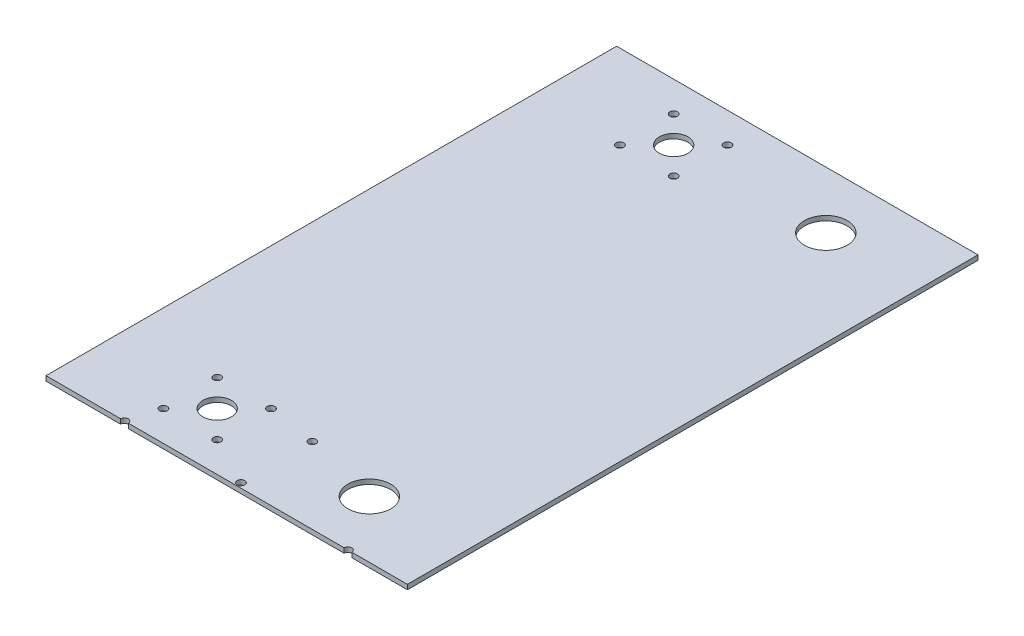
from build123d import *

# Parameters (mm, degrees)
SKETCH1_W           = 241.3
SKETCH1_H           = 381
BOSS_EXTRUDE1_DEPTH = 3.175
SKETCH7_R           = 14.2875
SKETCH7_R_2         = 9.525
SKETCH7_R_3         = 2.5527
AXLE_HOLES_DEPTH    = 226.514418885
SKETCH10_R          = 2.5527
CUT_EXTRUDE5_DEPTH  = 226.514418885


with BuildPart() as part:
    # Sketch1 → Boss-Extrude1 (new body)
    with BuildSketch(Plane(origin=(0, 0, 0), x_dir=(1, 0, 0), z_dir=(0, 1, 0))):
        Rectangle(SKETCH1_W, SKETCH1_H)
    extrude(amount=BOSS_EXTRUDE1_DEPTH)

    # Sketch7 → Axle Holes (cut, through all)
    with BuildSketch(Plane(origin=(0, 3.175, 0), x_dir=(1, 0, 0), z_dir=(0, 1, 0))):
        with Locations((57.15, -152.4)):
            Circle(SKETCH7_R)
        with Locations((57.15, 152.4)):
            Circle(SKETCH7_R)
        with Locations((-44.45, 152.4)):
            Circle(SKETCH7_R_2)
        with Locations((-44.45, -152.4)):
            Circle(SKETCH7_R_2)
        with Locations((-62.410512242, 170.360512242)):
            Circle(SKETCH7_R_3)
        with Locations((-26.489487758, 170.360512242)):
            Circle(SKETCH7_R_3)
        with Locations((-26.489487758, 134.439487758)):
            Circle(SKETCH7_R_3)
        with Locations((-62.410512242, 134.439487758)):
            Circle(SKETCH7_R_3)
        with Locations((-62.410512242, -134.439487758)):
            Circle(SKETCH7_R_3)
        with Locations((-26.489487758, -134.439487758)):
            Circle(SKETCH7_R_3)
        with Locations((-26.489487758, -170.360512242)):
            Circle(SKETCH7_R_3)
        with Locations((-62.410512242, -170.360512242)):
            Circle(SKETCH7_R_3)
    extrude(amount=-AXLE_HOLES_DEPTH, mode=Mode.SUBTRACT)

    # Sketch10 → Cut-Extrude5 (cut, through all)
    with BuildSketch(Plane(origin=(0, 3.175, 0), x_dir=(1, 0, 0), z_dir=(0, 1, 0))):
        with Locations((6.35, -139.7)):
            Circle(SKETCH10_R)
        with Locations((-68.2625, -190.5)):
            Circle(SKETCH10_R)
        with Locations((6.35, -187.325)):
            Circle(SKETCH10_R)
        with Locations((80.9625, -190.5)):
            Circle(SKETCH10_R)
    extrude(amount=-CUT_EXTRUDE5_DEPTH, mode=Mode.SUBTRACT)


solid = part.part
